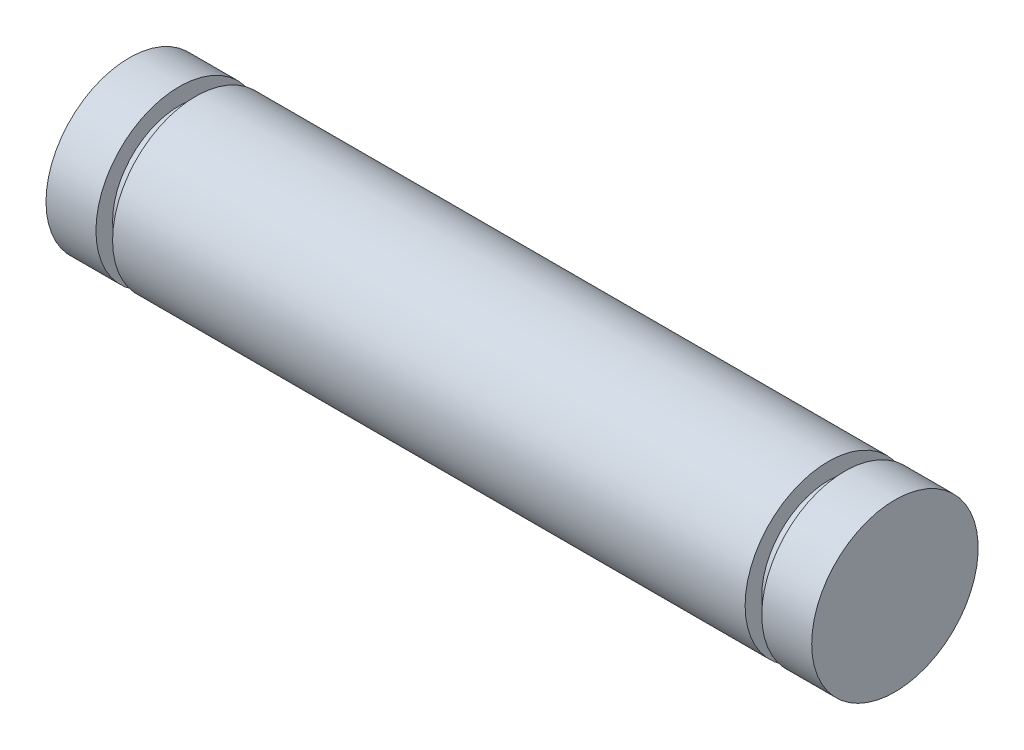
from build123d import *


with BuildPart() as part:
    # ｽｹｯﾁ1 → 回転1 (revolve)
    with BuildSketch(Plane.XY):
        Polygon((0, 0), (0, 5), (19, 5), (19, 4), (20, 4), (20, 5), (23, 5), (23, 0), align=None)
    revolve(axis=Axis((0, 0, 0), (1, 0, 0)))

    # ﾐﾗｰ1: part across plane


with BuildPart() as part_1:
    add(part.part)
    add(part.part.mirror(Plane(origin=(0, 0, 0), x_dir=(0, 0, 1), z_dir=(1, 0, 0))))


solid = part_1.part
